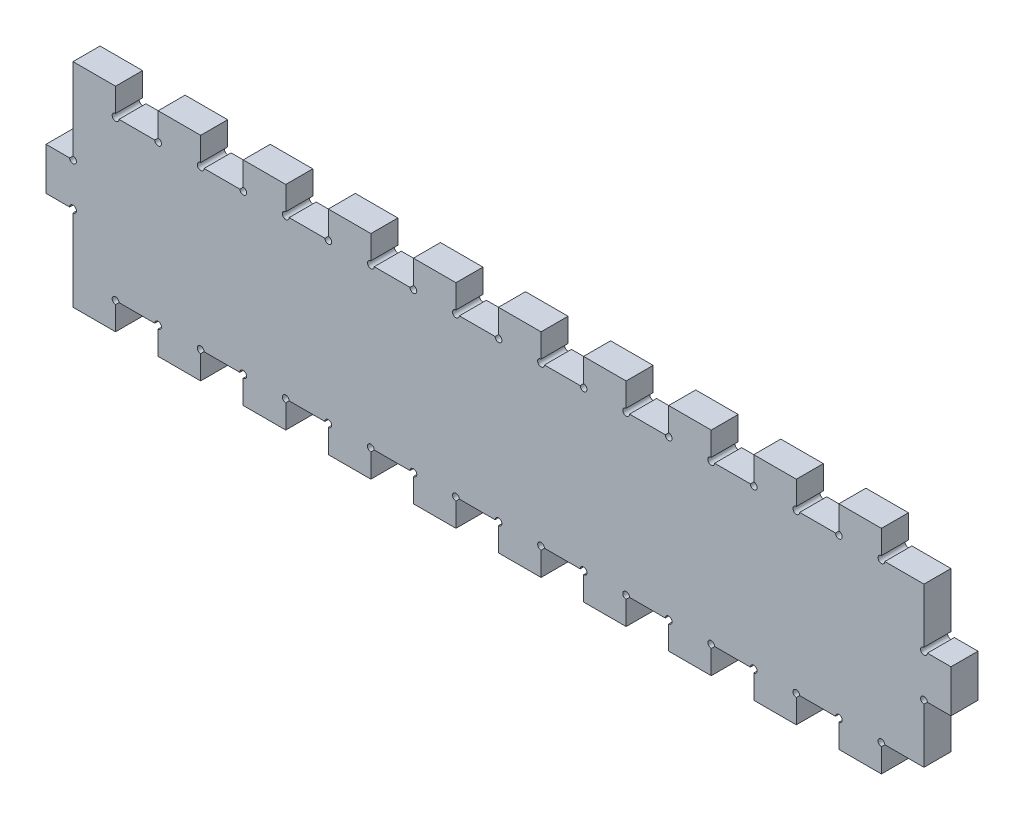
from build123d import *

# Parameters (mm, degrees)
BOSS_EXTRUDE1_START            = 6.35
BOSS_EXTRUDE1_OUTLINE_W        = 200
BOSS_EXTRUDE1_OUTLINE_H        = 6.35
BOSS_EXTRUDE1_DEPTH            = 37.301670771
BOSS_EXTRUDE1_2_OUTLINE_W      = 10
BOSS_EXTRUDE1_2_OUTLINE_H      = 6.35
BOSS_EXTRUDE1_2_DEPTH          = 50.001670771
BOSS_EXTRUDE1_START_2          = 20.000835386
BOSS_EXTRUDE1_3_OUTLINE_W      = 6.35
BOSS_EXTRUDE1_3_OUTLINE_H      = 6.35
BOSS_EXTRUDE1_3_DEPTH          = 10
F_1_16_0_0625_DIAMETER_HOLE1_D = 1.5875


# Read off the part's stored shape, not the designer's step: Boss-Extrude1
with BuildPart() as part:
    # Boss-Extrude1 outline → Boss-Extrude1 (new body)
    with BuildSketch(Plane(origin=(0, 0, 0), x_dir=(1, 0, 0), z_dir=(0, 1, 0)).offset(BOSS_EXTRUDE1_START)):
        with Locations((100, -3.175)):
            Rectangle(BOSS_EXTRUDE1_OUTLINE_W, BOSS_EXTRUDE1_OUTLINE_H)
    extrude(amount=BOSS_EXTRUDE1_DEPTH)

    # Boss-Extrude1 2 outline → Boss-Extrude1 2 (add)
    with BuildSketch(Plane(origin=(0, 0, 0), x_dir=(1, 0, 0), z_dir=(0, 1, 0))):
        with Locations((25, -3.175)):
            Rectangle(BOSS_EXTRUDE1_2_OUTLINE_W, BOSS_EXTRUDE1_2_OUTLINE_H)
        with Locations((45, -3.175)):
            Rectangle(BOSS_EXTRUDE1_2_OUTLINE_W, BOSS_EXTRUDE1_2_OUTLINE_H)
        with Locations((5, -3.175)):
            Rectangle(BOSS_EXTRUDE1_2_OUTLINE_W, BOSS_EXTRUDE1_2_OUTLINE_H)
        with Locations((65, -3.175)):
            Rectangle(BOSS_EXTRUDE1_2_OUTLINE_W, BOSS_EXTRUDE1_2_OUTLINE_H)
        with Locations((85, -3.175)):
            Rectangle(BOSS_EXTRUDE1_2_OUTLINE_W, BOSS_EXTRUDE1_2_OUTLINE_H)
        with Locations((105, -3.175)):
            Rectangle(BOSS_EXTRUDE1_2_OUTLINE_W, BOSS_EXTRUDE1_2_OUTLINE_H)
        with Locations((125, -3.175)):
            Rectangle(BOSS_EXTRUDE1_2_OUTLINE_W, BOSS_EXTRUDE1_2_OUTLINE_H)
        with Locations((145, -3.175)):
            Rectangle(BOSS_EXTRUDE1_2_OUTLINE_W, BOSS_EXTRUDE1_2_OUTLINE_H)
        with Locations((165, -3.175)):
            Rectangle(BOSS_EXTRUDE1_2_OUTLINE_W, BOSS_EXTRUDE1_2_OUTLINE_H)
        with Locations((185, -3.175)):
            Rectangle(BOSS_EXTRUDE1_2_OUTLINE_W, BOSS_EXTRUDE1_2_OUTLINE_H)
    extrude(amount=BOSS_EXTRUDE1_2_DEPTH)

    # Boss-Extrude1 3 outline → Boss-Extrude1 3 (add)
    with BuildSketch(Plane(origin=(0, 0, 0), x_dir=(1, 0, 0), z_dir=(0, 1, 0)).offset(BOSS_EXTRUDE1_START_2)):
        with Locations((-3.175, -3.175)):
            Rectangle(BOSS_EXTRUDE1_3_OUTLINE_W, BOSS_EXTRUDE1_3_OUTLINE_H)
        with Locations((203.175, -3.175)):
            Rectangle(BOSS_EXTRUDE1_3_OUTLINE_W, BOSS_EXTRUDE1_3_OUTLINE_H)
    extrude(amount=BOSS_EXTRUDE1_3_DEPTH)

    # 1/16 (0.0625) Diameter Hole1 (through all)
    with Locations(Plane.XY.offset(6.35)):
        with Locations((10, 43.651670771), (20, 43.651670771), (20, 6.35), (10, 6.35), (29.999999878, 43.651670771), (39.999999878, 43.651670771), (39.999999878, 6.35), (29.999999878, 6.35), (49.999999756, 43.651670771), (59.999999756, 43.651670771), (59.999999756, 6.35), (49.999999756, 6.35), (69.999999634, 43.651670771), (79.999999634, 43.651670771), (79.999999634, 6.35), (69.999999634, 6.35), (89.999999512, 43.651670771), (99.999999512, 43.651670771), (99.999999512, 6.35), (89.999999512, 6.35), (109.99999939, 43.651670771), (119.99999939, 43.651670771), (119.99999939, 6.35), (109.99999939, 6.35), (129.999999268, 43.651670771), (139.999999268, 43.651670771), (139.999999268, 6.35), (129.999999268, 6.35), (149.999999146, 43.651670771), (159.999999146, 43.651670771), (159.999999146, 6.35), (149.999999146, 6.35), (169.999999024, 43.651670771), (179.999999024, 43.651670771), (179.999999024, 6.35), (169.999999024, 6.35), (190, 43.651670771), (190, 6.35), (200, 20.000835386), (200, 30.000835386), (0, 30.000835386), (0, 20.000835386)):
            Hole(F_1_16_0_0625_DIAMETER_HOLE1_D / 2)


solid = part.part
